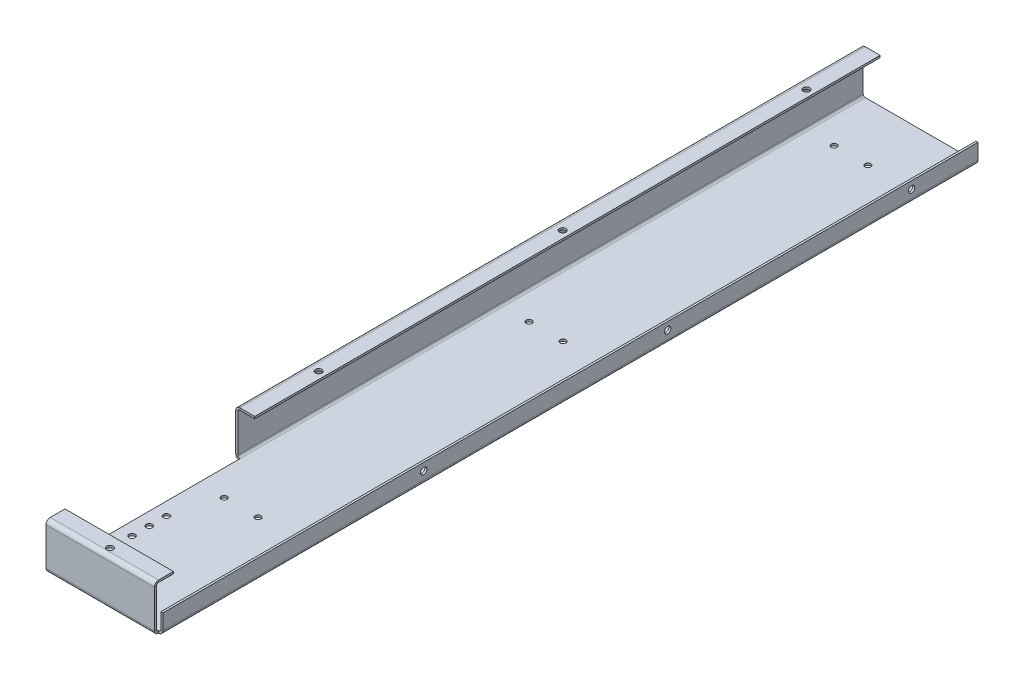
from build123d import *

# Parameters (mm, degrees)
SKETCH1_W                      = 160
SKETCH1_H                      = 1203
BOSS_EXTRUDE1_DEPTH            = 3.175
CONVERT_SOLID1_OUTLINE_W       = 160
CONVERT_SOLID1_OUTLINE_H       = 1203
CONVERT_SOLID1_DEPTH           = 0.13716
EDGE_FLANGE1_DEPTH             = 1203
EDGE_FLANGE2_START             = -160
EDGE_FLANGE2_DEPTH             = 160
EDGE_FLANGE2_2_DEPTH           = 923
EDGE_FLANGE3_DEPTH             = 923
EDGE_FLANGE3_BEND_DEPTH        = 160
F_9_5_9_5_DIAMETER_HOLE9_D     = 9.5
F_9_5_9_5_DIAMETER_HOLE9_DEPTH = 3.03784
F_9_5_9_5_DIAMETER_HOLE8_D     = 9.5
F_9_5_9_5_DIAMETER_HOLE8_DEPTH = 3.03784
M6_CLEARANCE_HOLE1_D           = 8.5
M8_CLEARANCE_HOLE1_D           = 9


# Read off the part's stored shape, not the designer's step: Convert-Solid1, Edge-Flange2
# Sheet-metal steps are written as plain solids
with BuildPart() as part:
    # Sketch1 → Boss-Extrude1 (new body)
    with BuildSketch(Plane(origin=(0, 0, 0), x_dir=(1, 0, 0), z_dir=(0, 1, 0))):
        with Locations((80, -601.5)):
            Rectangle(SKETCH1_W, SKETCH1_H)
    extrude(amount=BOSS_EXTRUDE1_DEPTH)

    # Convert-Solid1 outline → Convert-Solid1 (cut)
    with BuildSketch(Plane(origin=(0, 0, 0), x_dir=(1, 0, 0), z_dir=(0, 1, 0))):
        with Locations((80, -601.5)):
            Rectangle(CONVERT_SOLID1_OUTLINE_W, CONVERT_SOLID1_OUTLINE_H)
    extrude(amount=CONVERT_SOLID1_DEPTH, mode=Mode.SUBTRACT)

    # Edge-Flange1 section (across the edge) → Edge-Flange1 (add)
    with BuildSketch(Plane(origin=(163.175, 3.175, 1203), x_dir=(-1, 0, 0), z_dir=(0, 0, -1))):
        with BuildLine():
            Line((-3.03784, 3.175), (-3.03784, 26))
            Line((-3.03784, 26), (0, 26))
            Line((0, 26), (0, 3.175))
            ThreePointArc((0, 3.175), (0.92993597, 0.92993597), (3.175, 0))
            Line((3.175, 0), (3.175, -3.03784))
            ThreePointArc((3.175, -3.03784), (-1.218141294, -1.218141294), (-3.03784, 3.175))
        make_face()
    extrude(amount=EDGE_FLANGE1_DEPTH)

    # Edge-Flange2 outline → Edge-Flange2 (add)
    with BuildSketch(Plane(origin=(0, 3.175, 0), x_dir=(0, 0, 1), z_dir=(-1, 0, 0)).offset(EDGE_FLANGE2_START)):
        with BuildLine():
            Line((1209.21284, 58.74932), (1206.175, 58.74932))
            Line((1206.175, 58.74932), (1206.175, 3.175))
            ThreePointArc((1206.175, 3.175), (1205.24506403, 0.92993597), (1203, 0))
            Line((1203, 0), (1203, -3.03784))
            ThreePointArc((1203, -3.03784), (1207.393141294, -1.218141294), (1209.21284, 3.175))
            Line((1209.21284, 3.175), (1209.21284, 58.74932))
        make_face()
    extrude(amount=EDGE_FLANGE2_DEPTH)

    # Edge-Flange2 2 outline → Edge-Flange2 2 (add)
    with BuildSketch(Plane.XY):
        with BuildLine():
            Line((-6.21284, 61.92432), (-6.21284, 6.35))
            ThreePointArc((-6.21284, 6.35), (-4.393141294, 1.956858706), (0, 0.13716))
            Line((0, 0.13716), (0, 3.175))
            ThreePointArc((0, 3.175), (-2.24506403, 4.10493597), (-3.175, 6.35))
            Line((-3.175, 6.35), (-3.175, 61.92432))
            Line((-3.175, 61.92432), (-6.21284, 61.92432))
        make_face()
    extrude(amount=EDGE_FLANGE2_2_DEPTH)

    # Edge-Flange3 section (across the edge) → Edge-Flange3 (add)
    with BuildSketch(Plane(origin=(-3.175, 65.09932, 0), x_dir=(0, -1, 0), z_dir=(0, 0, 1))):
        with BuildLine():
            Line((-3.03784, 3.175), (-3.03784, 25))
            Line((-3.03784, 25), (0, 25))
            Line((0, 25), (0, 3.175))
            ThreePointArc((0, 3.175), (0.92993597, 0.92993597), (3.175, 0))
            Line((3.175, 0), (3.175, -3.03784))
            ThreePointArc((3.175, -3.03784), (-1.218141294, -1.218141294), (-3.03784, 3.175))
        make_face()
    extrude(amount=EDGE_FLANGE3_DEPTH)

    # Edge-Flange3 section 2 (across the edge) → Edge-Flange3 bend (add)
    with BuildSketch(Plane(origin=(0, 65.09932, 1206.175), x_dir=(0, -1, 0), z_dir=(1, 0, 0))):
        with BuildLine():
            Line((-3.03784, 3.175), (-3.03784, 25))
            Line((-3.03784, 25), (0, 25))
            Line((0, 25), (0, 3.175))
            ThreePointArc((0, 3.175), (0.92993597, 0.92993597), (3.175, 0))
            Line((3.175, 0), (3.175, -3.03784))
            ThreePointArc((3.175, -3.03784), (-1.218141294, -1.218141294), (-3.03784, 3.175))
        make_face()
    extrude(amount=EDGE_FLANGE3_BEND_DEPTH)

    # Ø9.5 (9.5) Diameter Hole9
    with Locations(Plane(origin=(166.21284, 0, 0), x_dir=(0, 0, -1), z_dir=(1, 0, 0))):
        with Locations((-98, 18.13716), (-458, 18.13716), (-818, 18.13716)):
            Hole(F_9_5_9_5_DIAMETER_HOLE9_D / 2, depth=F_9_5_9_5_DIAMETER_HOLE9_DEPTH)

    # Ø9.5 (9.5) Diameter Hole8
    with Locations(Plane(origin=(0, 68.13716, 0), x_dir=(1, 0, 0), z_dir=(0, 1, 0))):
        with Locations((11.21284, -98), (11.21284, -458), (11.21284, -818), (83.21284, -1198)):
            Hole(F_9_5_9_5_DIAMETER_HOLE8_D / 2, depth=F_9_5_9_5_DIAMETER_HOLE8_DEPTH)

    # M6 Clearance Hole1 (through all)
    with Locations(Plane(origin=(0, 3.175, 0), x_dir=(1, 0, 0), z_dir=(0, 1, 0))):
        with Locations((38.41286, -84.5878), (88.41286, -84.5878), (88.41286, -534.5878), (38.41286, -534.5878), (38.41286, -984.5878), (88.41286, -984.5878)):
            Hole(M6_CLEARANCE_HOLE1_D / 2)

    # M8 Clearance Hole1 (through all)
    with Locations(Plane(origin=(0, 0.13716, 0), x_dir=(-1, 0, 0), z_dir=(0, -1, 0))):
        with Locations((-19.05, -1152.06284), (-19.05, -1126.66284), (-19.05, -1101.26284), (-19.05, -1075.86284), (-19.05, -1050.46284)):
            Hole(M8_CLEARANCE_HOLE1_D / 2)


solid = part.part
